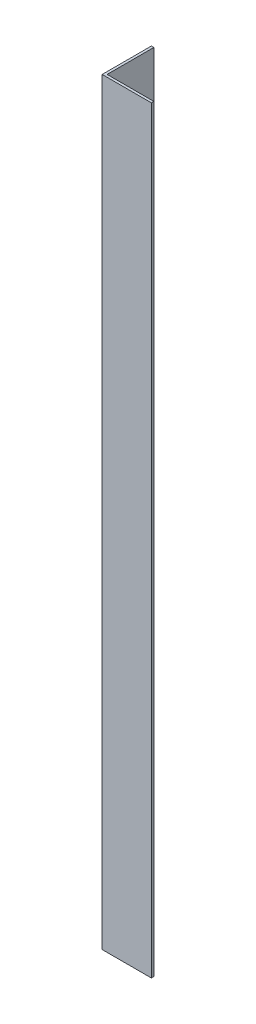
from build123d import *

# Parameters (mm, degrees)
EXTRUDE_1_DEPTH = 231


with BuildPart() as part:
    # Эскиз1 → Бобышка-Вытянуть1 (new body)
    with BuildSketch(Plane(origin=(0, 0, 0), x_dir=(1, 0, 0), z_dir=(0, 1, 0))):
        Polygon((0, 0), (0, 15), (0.75, 15), (0.75, 0.75), (15, 0.75), (15, 0), align=None)
    extrude(amount=EXTRUDE_1_DEPTH)


solid = part.part
